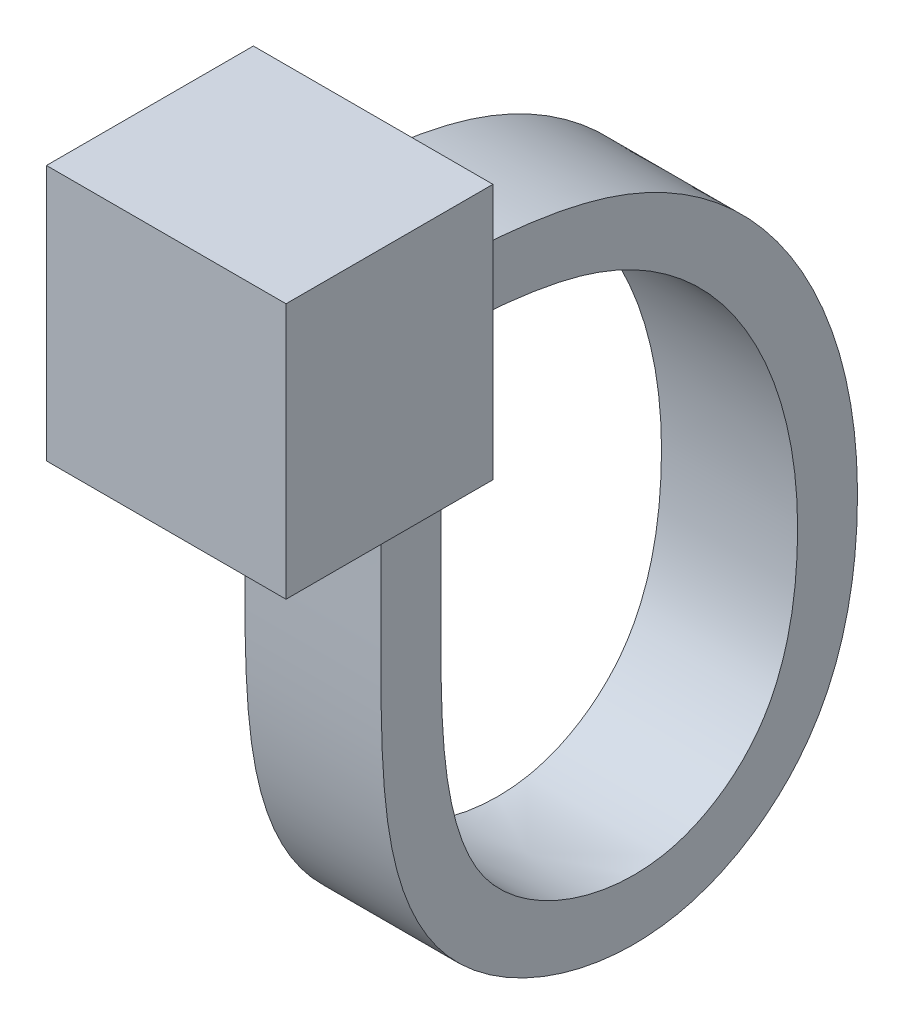
from build123d import *

# Parameters (mm, degrees)
CROQUIS1_W              = 4.4
CROQUIS1_H              = 4.7
SALIENTE_EXTRUIR1_DEPTH = 3.8
BARRER1_START           = 0.95
BARRER1_DEPTH           = 2.5


# Read off the part's stored shape, not the designer's step: Barrer1
with BuildPart() as part:
    # Croquis1 → Saliente-Extruir1 (new body)
    with BuildSketch(Plane.XY):
        with Locations((2.2, -2.35)):
            Rectangle(CROQUIS1_W, CROQUIS1_H)
    extrude(amount=SALIENTE_EXTRUIR1_DEPTH)

    # Barrer1 outline → Barrer1 (add)
    with BuildSketch(Plane.YZ.offset(BARRER1_START)):
        with BuildLine():
            Line((-4.7, 0), (-4.7, 1.1))
            add(Edge.make_bspline(
                [(-4.7, 1.1), (-5.000758978, 1.100023998), (-5.968697698, 1.097151518), (-7.230209237, 1.108454752), (-8.30048718, 1.108928898), (-9.974534532, 1.049612746), (-11.50473727, 0.78159756), (-12.575444595, 0.084936975), (-13.10579945, -0.375357222), (-13.618580368, -1.005180074), (-14.052581859, -1.89061252), (-14.28561183, -2.757672314), (-14.358186067, -3.561965374), (-14.302352893, -4.113148663), (-14.187926862, -4.638865984), (-14.0162165, -5.151115513), (-13.624341836, -5.831386177), (-13.183515297, -6.337665692), (-12.782315172, -6.675062559), (-12.247006905, -7.039657176), (-11.439551935, -7.388052079), (-10.481539211, -7.578436172), (-9.621890057, -7.648592702), (-8.651764284, -7.651644133), (-7.425202473, -7.504838331), (-6.334355277, -7.178425639), (-5.457863107, -6.789495572), (-4.6172894, -6.31587221), (-3.616865788, -5.505072705), (-2.773003291, -4.406686932), (-2.342684459, -3.467983764), (-2.098727141, -2.689905421), (-1.924123241, -1.86998585), (-1.814958981, -0.811189651), (-1.800266248, -0.215359683), (-1.8, 0)],
                knots=[0, 0, 0, 0, 0.047683783, 0.083333333, 0.130150735, 0.166666667, 0.25, 0.272449765, 0.28125, 0.3125, 0.34375, 0.3671875, 0.390625, 0.4140625, 0.415114366, 0.4375, 0.4609375, 0.484375, 0.497245754, 0.5078125, 0.54296875, 0.578125, 0.599081823, 0.625, 0.671875, 0.71875, 0.736138204, 0.765625, 0.8125, 0.859375, 0.89453125, 0.904141726, 0.9296875, 0.96484375, 1, 1, 1, 1], degree=3))
            Line((-1.8, 0), (-2.9, 0))
            add(Edge.make_bspline(
                [(-4.7, 0), (-5.003717084, -2.3998e-05), (-5.976825462, -0.002980359), (-7.238023095, 0.008431986), (-8.294752299, 0.009385515), (-9.868971065, -0.046131942), (-11.155208938, -0.304583521), (-11.917477134, -0.798530011), (-12.296639917, -1.131261135), (-12.681977601, -1.598987807), (-13.018347685, -2.285006804), (-13.197757517, -2.953458974), (-13.251364009, -3.561062573), (-13.210572039, -3.9568545), (-13.129189092, -4.331153137), (-13.007794292, -4.693082092), (-12.723430803, -5.18884591), (-12.401378127, -5.557158242), (-12.116219319, -5.797929095), (-11.732146996, -6.058693143), (-11.123005188, -6.326164801), (-10.329674106, -6.487046392), (-9.579742628, -6.547390381), (-8.718606053, -6.551563514), (-7.648069443, -6.421789708), (-6.705980213, -6.139792478), (-5.955770762, -5.806620182), (-5.242101235, -5.404260758), (-4.409968195, -4.728203482), (-3.720375608, -3.828768716), (-3.369350404, -3.06448508), (-3.165205001, -2.415244209), (-3.015333882, -1.712560747), (-2.913361496, -0.738198337), (-2.899733752, -0.191029245), (-2.9, 0)],
                knots=[0, 0, 0, 0, 0.047683783, 0.083333333, 0.130150735, 0.166666667, 0.25, 0.272449765, 0.28125, 0.3125, 0.34375, 0.3671875, 0.390625, 0.4140625, 0.415114366, 0.4375, 0.4609375, 0.484375, 0.497245754, 0.5078125, 0.54296875, 0.578125, 0.599081823, 0.625, 0.671875, 0.71875, 0.736138204, 0.765625, 0.8125, 0.859375, 0.89453125, 0.904141726, 0.9296875, 0.96484375, 1, 1, 1, 1], degree=3))
        make_face()
    extrude(amount=BARRER1_DEPTH)


solid = part.part
